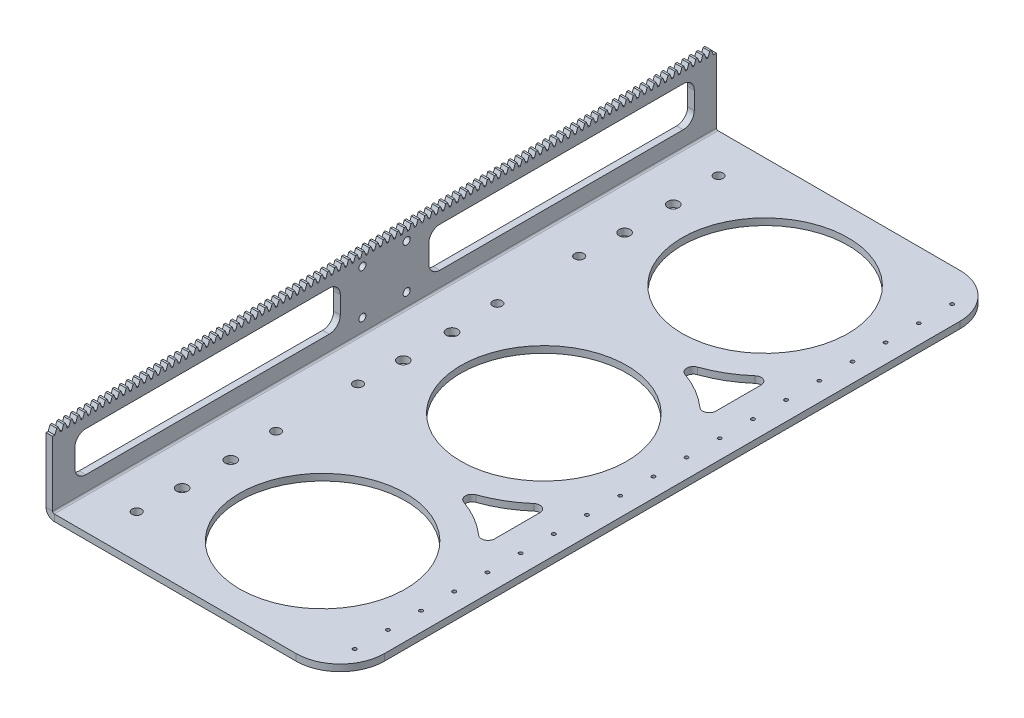
from build123d import *

# Parameters (mm, degrees)
SM_BASE_FLANGE_2_DEPTH     = 150
EXTRUDE_1_DEPTH            = 3
SKETCH_12_R                = 37.5
CUT_EXTRUDE_2_DEPTH        = 202.097146922
HOLE_WIZARD_M3_1_D         = 3.2
PATTERN_LINEAR_3_COUNT     = 95
PATTERN_LINEAR_3_PITCH     = 3.14
PATTERN_LINEAR_4_COUNT     = 2
PATTERN_LINEAR_4_PITCH     = 100
PATTERN_LINEAR_4_COL_COUNT = 2
PATTERN_LINEAR_4_COL_PITCH = 100
CUT_EXTRUDE_3_DEPTH        = 202.097146922
SKETCH_20_W                = 120
SKETCH_20_H                = 18
CUT_EXTRUDE_4_DEPTH        = 202.097146922
FILLET_2_R                 = 5
FILLET_2_OF_MIRROR_1_R     = 5
SKETCH_21_R                = 2.5
CUT_EXTRUDE_5_DEPTH        = 10
HOLE_WIZARD_M4_1_D         = 4.2
HOLE_WIZARD_M4_1_DEPTH     = 20
HOLE_WIZARD_M4_1_TIP       = 1.2618073
FILLET_3_R                 = 3
FILLET_4_R                 = 20
M2X0_4_1_D                 = 1.6


# Sheet-metal steps are written as plain solids
with BuildPart() as part:
    # 草圖8 → 基材-凸緣2 (new, symmetric)
    with BuildSketch(Plane.XY):
        with BuildLine():
            Line((130, 0), (0.7366, 0))
            ThreePointArc((0.7366, 0), (0.215745145, 0.215745145), (0, 0.7366))
            Line((0, 0.7366), (0, 30))
            Line((0, 30), (-3, 30))
            Line((-3, 30), (-3, 0.7366))
            ThreePointArc((-3, 0.7366), (-1.905575199, -1.905575199), (0.7366, -3))
            Line((0.7366, -3), (130, -3))
            Line((130, -3), (130, 0))
        make_face()
    extrude(amount=SM_BASE_FLANGE_2_DEPTH, both=True)

    # 草圖18 → 填料-伸長1 (add)
    with BuildSketch(Plane.ZY.offset(3)):
        Polygon((149, 30), (148.181066973, 32.25), (147.338211115, 32.25), (146.519278088, 30), align=None)
    extrude_1 = extrude(amount=-EXTRUDE_1_DEPTH)

    # 草圖12 → 除料-伸長2 (cut, through all)
    with BuildSketch(Plane(origin=(0, 0, 0), x_dir=(1, 0, 0), z_dir=(0, 1, 0))):
        with Locations(Location((72, 0, 0), (0, 0, 270))):
            Circle(SKETCH_12_R)
    cut_extrude_2 = extrude(amount=-CUT_EXTRUDE_2_DEPTH, mode=Mode.SUBTRACT)

    # M3 餘隙孔1 (through all)
    with Locations(Plane(origin=(0, 0, 0), x_dir=(0, 0, -1), z_dir=(1, 0, 0))):
        with Locations((10, 26.5), (-10, 26.5), (10, 6.5), (-10, 6.5)):
            Hole(HOLE_WIZARD_M3_1_D / 2)

    # 直線複製排列3: 填料-伸長1 ×95
    with Locations(*[(0, 0, -i * PATTERN_LINEAR_3_PITCH) for i in range(1, PATTERN_LINEAR_3_COUNT)]):
        add(extrude_1)

    # 直線複製排列4: 除料-伸長2 ×2
    with Locations(*[(0, 0, -i * PATTERN_LINEAR_4_PITCH) for i in range(1, PATTERN_LINEAR_4_COUNT)]):
        add(cut_extrude_2, mode=Mode.SUBTRACT)

    # 直線複製排列4 col: 除料-伸長2 ×2
    with Locations(*[(0, 0, i * PATTERN_LINEAR_4_COL_PITCH) for i in range(1, PATTERN_LINEAR_4_COL_COUNT)]):
        add(cut_extrude_2, mode=Mode.SUBTRACT)

    # 草圖19 → 除料-伸長3 (cut, through all)
    with BuildSketch(Plane(origin=(0, 0, 0), x_dir=(1, 0, 0), z_dir=(0, 1, 0))):
        with BuildLine():
            Line((110, 67.503846381), (110, 32.496153619))
            ThreePointArc((110, 32.496153619), (92.91879919, 45.413696617), (72, 50))
            ThreePointArc((72, 50), (92.91879919, 54.586303383), (110, 67.503846381))
        make_face()
    cut_extrude_3 = extrude(amount=-CUT_EXTRUDE_3_DEPTH, mode=Mode.SUBTRACT)

    # 草圖20 → 除料-伸長4 (cut, through all)
    with BuildSketch(Plane(origin=(0, 0, 0), x_dir=(0, 0, -1), z_dir=(1, 0, 0))):
        with Locations((80, 16.5)):
            Rectangle(SKETCH_20_W, SKETCH_20_H)
    cut_extrude_4 = extrude(amount=-CUT_EXTRUDE_4_DEPTH, mode=Mode.SUBTRACT)

    # 圓角2
    fillet_2_edges = [part.edges().sort_by_distance(p)[0] for p in [
        (-1.5, 25.5, -140),
        (-1.5, 7.5, -140),
        (-1.5, 7.5, -20),
        (-1.5, 25.5, -20),
    ]]
    fillet(fillet_2_edges, radius=FILLET_2_R)

    # 鏡射1: 除料-伸長3, 除料-伸長4 across plane
    add(cut_extrude_3.mirror(Plane.XY), mode=Mode.SUBTRACT)
    add(cut_extrude_4.mirror(Plane.XY), mode=Mode.SUBTRACT)

    # 圓角2 of 鏡射1
    fillet_2_of_mirror_1_edges = [part.edges().sort_by_distance(p)[0] for p in [
        (-1.5, 25.5, 140),
        (-1.5, 7.5, 140),
        (-1.5, 7.5, 20),
        (-1.5, 25.5, 20),
    ]]
    fillet(fillet_2_of_mirror_1_edges, radius=FILLET_2_OF_MIRROR_1_R)

    # 草圖21 → 除料-伸長5 (cut)
    with BuildSketch(Plane.XZ.offset(3)):
        with Locations(Location((19.5, -111, 0), (0, 0, 270))):
            Circle(SKETCH_21_R)
        with Locations(Location((19.5, -89, 0), (0, 0, 270))):
            Circle(SKETCH_21_R)
        with Locations(Location((19.5, 11, 0), (0, 0, 270))):
            Circle(SKETCH_21_R)
        with Locations(Location((19.5, -11, 0), (0, 0, 270))):
            Circle(SKETCH_21_R)
        with Locations(Location((19.5, 111, 0), (0, 0, 270))):
            Circle(SKETCH_21_R)
        with Locations(Location((19.5, 89, 0), (0, 0, 270))):
            Circle(SKETCH_21_R)
    extrude(amount=-CUT_EXTRUDE_5_DEPTH, mode=Mode.SUBTRACT)

    # M4 螺旋的螺孔鑽1
    with Locations(Plane(origin=(0, -3, 0), x_dir=(-1, 0, 0), z_dir=(0, -1, 0))):
        with Locations((-18.5, 132.5), (-18.5, 69.5), (-18.5, 32.5), (-18.5, -30.5), (-18.5, -67.5), (-18.5, -130.5)):
            Hole(HOLE_WIZARD_M4_1_D / 2, depth=HOLE_WIZARD_M4_1_DEPTH)
            with Locations((0, 0, -(HOLE_WIZARD_M4_1_DEPTH + HOLE_WIZARD_M4_1_TIP / 2))):  # 118° drill point
                Cone(0, HOLE_WIZARD_M4_1_D / 2, HOLE_WIZARD_M4_1_TIP, mode=Mode.SUBTRACT)

    # 圓角3
    fillet_3_edges = [part.edges().sort_by_distance(p)[0] for p in [
        (72, -1.5, -50),
        (110, -1.5, -67.503846381),
        (110, -1.5, -32.496153619),
        (110, -1.5, 67.503846381),
        (72, -1.5, 50),
        (110, -1.5, 32.496153619),
    ]]
    fillet(fillet_3_edges, radius=FILLET_3_R)

    # 圓角4
    fillet_4_edges = [part.edges().sort_by_distance(p)[0] for p in [
        (130, -1.5, 150),
        (130, -1.5, -150),
    ]]
    fillet(fillet_4_edges, radius=FILLET_4_R)

    # M2x0.4 螺紋孔1 (through all)
    with Locations(Plane(origin=(0, -3, 0), x_dir=(-1, 0, 0), z_dir=(0, -1, 0))):
        with Locations((-121.5, -135), (-121.5, -120), (-121.5, -105), (-121.5, -90), (-121.5, -75), (-121.5, -60), (-121.5, -45), (-121.5, -30), (-121.5, -15), (-121.5, 0), (-121.5, 15), (-121.5, 30), (-121.5, 45), (-121.5, 60), (-121.5, 75), (-121.5, 90), (-121.5, 105), (-121.5, 120), (-121.5, 135)):
            Hole(M2X0_4_1_D / 2)


solid = part.part
